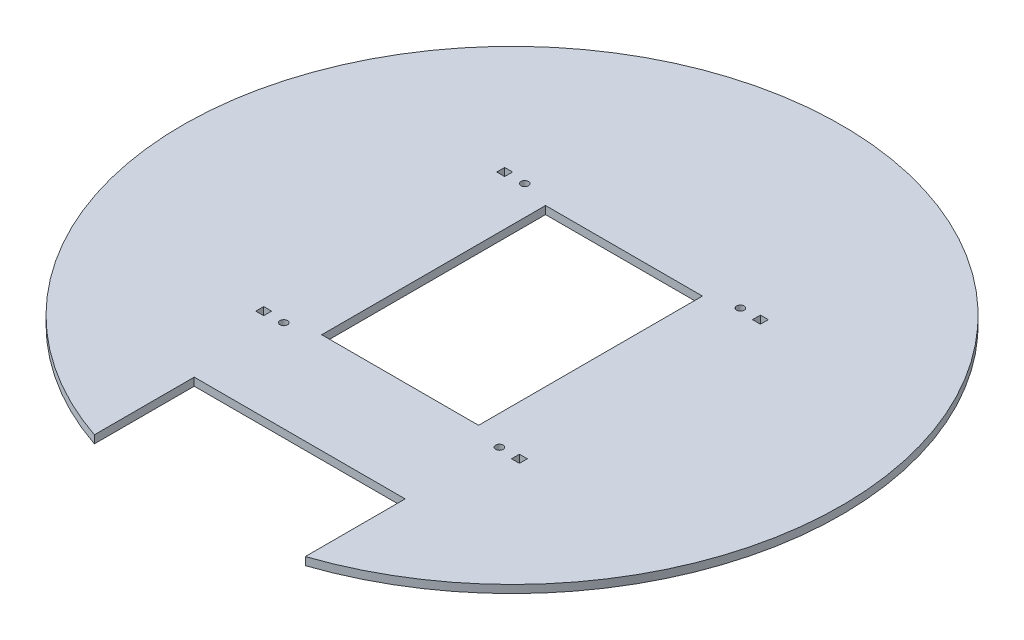
from build123d import *

# Parameters (mm, degrees)
SKETCH1_R           = 125
SKETCH1_W           = 59.5
SKETCH1_H           = 84.9
BOSS_EXTRUDE1_DEPTH = 3
SKETCH3_R           = 1.4224
SKETCH3_W           = 3
SKETCH3_H           = 3
CUT_EXTRUDE1_DEPTH  = 10
SKETCH6_W           = 80
SKETCH6_H           = 61.541292105
CUT_EXTRUDE3_DEPTH  = 3


with BuildPart() as part:
    # Sketch1 → Boss-Extrude1 (new body)
    with BuildSketch(Plane(origin=(0, 0, 0), x_dir=(1, 0, 0), z_dir=(0, 1, 0))):
        Circle(SKETCH1_R)
        Rectangle(SKETCH1_W, SKETCH1_H, mode=Mode.SUBTRACT)
    extrude(amount=BOSS_EXTRUDE1_DEPTH)

    # Sketch3 → Cut-Extrude1 (cut)
    with BuildSketch(Plane(origin=(0, 3, 0), x_dir=(1, 0, 0), z_dir=(0, 1, 0))):
        with Locations((-40.9, 45.7)):
            Circle(SKETCH3_R)
        with Locations((40.9, 45.7)):
            Circle(SKETCH3_R)
        with Locations((40.9, -45.7)):
            Circle(SKETCH3_R)
        with Locations((-40.9, -45.7)):
            Circle(SKETCH3_R)
        with Locations((-48.5, 45.7)):
            Rectangle(SKETCH3_W, SKETCH3_H)
        with Locations((48.5, 45.7)):
            Rectangle(SKETCH3_W, SKETCH3_H)
        with Locations((48.5, -45.7)):
            Rectangle(SKETCH3_W, SKETCH3_H)
        with Locations((-48.5, -45.7)):
            Rectangle(SKETCH3_W, SKETCH3_H)
    extrude(amount=-CUT_EXTRUDE1_DEPTH, mode=Mode.SUBTRACT)

    # Sketch6 → Cut-Extrude3 (cut)
    with BuildSketch(Plane(origin=(0, 3, 0), x_dir=(1, 0, 0), z_dir=(0, 1, 0))):
        with Locations((0, -111.320646053)):
            Rectangle(SKETCH6_W, SKETCH6_H)
    extrude(amount=-CUT_EXTRUDE3_DEPTH, mode=Mode.SUBTRACT)


solid = part.part
